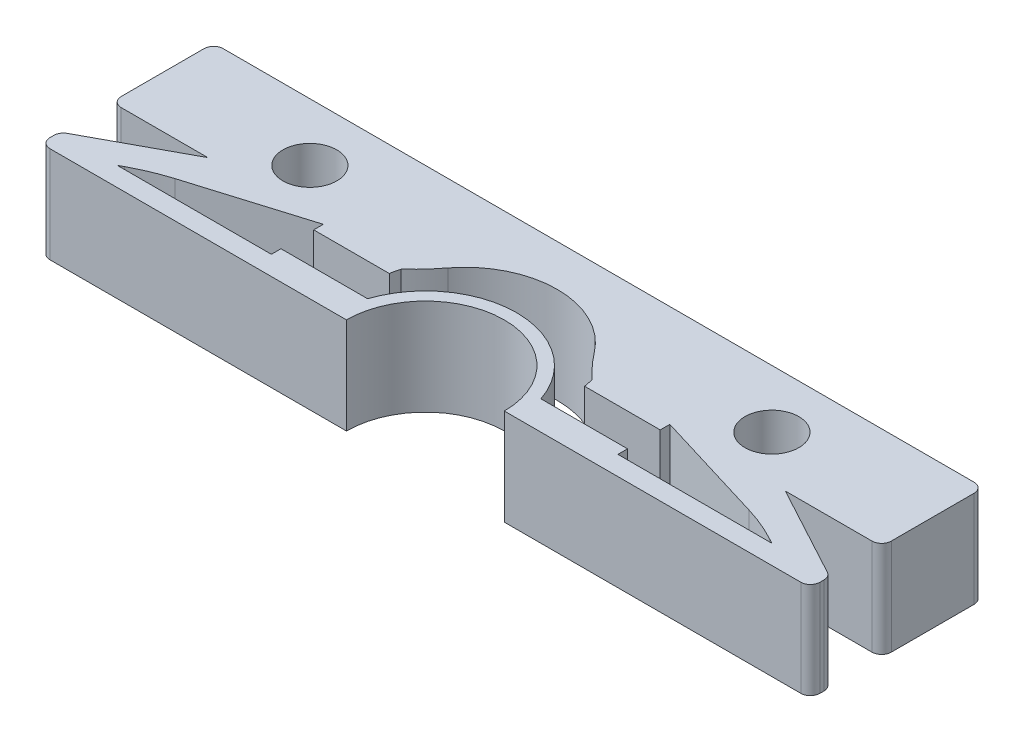
from build123d import *

# Parameters (mm, degrees)
BOSS_EXTRUDE1_DEPTH     = 5
CUT_EXTRUDE1_DEPTH      = 5
CUT_EXTRUDE1_DEPTH_BACK = 10
SKETCH2_R               = 1.4
FILLET1_R               = 10
FILLET2_R               = 0.5
CUT_EXTRUDE3_DEPTH      = 7
SKETCH6_W               = 4.5
SKETCH6_H               = 5
BOSS_EXTRUDE2_DEPTH     = 0.5
SKETCH7_W               = 9
SKETCH7_H               = 1
BOSS_EXTRUDE3_DEPTH     = 5
BOSS_EXTRUDE4_DEPTH     = 5
CUT_EXTRUDE5_START      = 5
SKETCH11_R              = 4.1
CUT_EXTRUDE5_DEPTH      = 5
CUT_EXTRUDE7_DEPTH      = 5
FILLET3_R               = 10


with BuildPart() as part:
    # Sketch1 → Boss-Extrude1 (new body)
    with BuildSketch(Plane(origin=(0, 0, 0), x_dir=(1, 0, 0), z_dir=(0, 1, 0))):
        Polygon((0, 0), (0, 9), (40, 9), (40, 0), (24, 0), (24, 5), (16, 5), (16, 0), align=None)
    extrude(amount=BOSS_EXTRUDE1_DEPTH)

    # Sketch2 → Cut-Extrude1 (cut, two sides: drawn at the far end of the back side and taken through both)
    with BuildSketch(Plane(origin=(0, 5, 0), x_dir=(1, 0, 0), z_dir=(0, 1, 0)).offset(-CUT_EXTRUDE1_DEPTH_BACK)):
        with Locations(Location((8, 6, 0), (0, 0, 270))):
            Circle(SKETCH2_R)
        with Locations(Location((32, 6, 0), (0, 0, 270))):
            Circle(SKETCH2_R)
        Polygon((5, 3.7), (0, 3.7), (0, 1), align=None)
        Polygon((13, 1), (8, 3.7), (3, 1), align=None)
        Polygon((16, 3.7), (11, 3.7), (16, 1), align=None)
        Polygon((24, 3.7), (24, 1), (29, 3.7), align=None)
        Polygon((32, 3.7), (27, 1), (37, 1), align=None)
        Polygon((40, 3.7), (35, 3.7), (40, 1), align=None)
    extrude(amount=CUT_EXTRUDE1_DEPTH + CUT_EXTRUDE1_DEPTH_BACK, mode=Mode.SUBTRACT)

    # Fillet1
    fillet1_edges = [part.edges().sort_by_distance(p)[0] for p in [
        (32, 2.5, -3.7),
        (8, 2.5, -3.7),
    ]]
    fillet(fillet1_edges, radius=FILLET1_R)

    # Fillet2
    fillet2_edges = [part.edges().sort_by_distance(p)[0] for p in [
        (0, 2.5, 0),
        (0, 2.5, -9),
        (40, 2.5, -9),
        (40, 2.5, 0),
        (24, 2.5, 0),
        (24, 2.5, -5),
        (16, 2.5, -5),
        (16, 2.5, 0),
        (0, 2.5, -1),
        (0, 2.5, -3.7),
        (16, 2.5, -3.7),
        (16, 2.5, -1),
        (24, 2.5, -3.7),
        (24, 2.5, -1),
        (40, 2.5, -3.7),
        (40, 2.5, -1),
    ]]
    fillet(fillet2_edges, radius=FILLET2_R)

    # Sketch4 → Cut-Extrude3 (cut)
    with BuildSketch(Plane(origin=(0, 5, 0), x_dir=(1, 0, 0), z_dir=(0, 1, 0))):
        Polygon((10.483197095, 1), (8, 2.335141884), (5.076146091, 1.898147599), (11, 3.7), (16.021662669, 1), align=None)
        Polygon((29.516802905, 1), (32, 2.335141884), (34.923853909, 1.898147599), (29, 3.7), (23.978337331, 1), align=None)
    extrude(amount=-CUT_EXTRUDE3_DEPTH, mode=Mode.SUBTRACT)

    # Sketch6 → Boss-Extrude2 (add)
    with BuildSketch(Plane.XY.offset(-3.7)):
        with Locations((13.25, 2.5)):
            Rectangle(SKETCH6_W, SKETCH6_H)
        with Locations((26.75, 2.5)):
            Rectangle(SKETCH6_W, SKETCH6_H)
    boss_extrude2 = extrude(amount=BOSS_EXTRUDE2_DEPTH)

    # Mirror1: Boss-Extrude2 across plane
    add(boss_extrude2.mirror(Plane.XY.offset(-2.35)))

    # Sketch7 → Boss-Extrude3 (add)
    with BuildSketch(Plane(origin=(0, 5, 0), x_dir=(1, 0, 0), z_dir=(0, 1, 0))):
        with Locations((20, 0.5)):
            Rectangle(SKETCH7_W, SKETCH7_H)
    extrude(amount=-BOSS_EXTRUDE3_DEPTH)

    # Sketch9 → Boss-Extrude4 (add)
    with BuildSketch(Plane(origin=(0, 5, 0), x_dir=(1, 0, 0), z_dir=(0, 1, 0))):
        with BuildLine():
            ThreePointArc((16.02382093, 1), (20, 4.1), (23.97617907, 1))
            Line((23.97617907, 1), (24.5, 1))
            Line((24.5, 1), (24.5, 1.5))
            ThreePointArc((24.5, 1.5), (20, 4.74341649), (15.5, 1.5))
            Line((15.5, 1.5), (15.5, 1))
            Line((15.5, 1), (16.02382093, 1))
        make_face()
    extrude(amount=-BOSS_EXTRUDE4_DEPTH)

    # Sketch11 → Cut-Extrude5 (cut)
    with BuildSketch(Plane(origin=(0, 0, 0), x_dir=(1, 0, 0), z_dir=(0, 1, 0)).offset(CUT_EXTRUDE5_START)):
        with Locations((20, 0)):
            Circle(SKETCH11_R)
    extrude(amount=-CUT_EXTRUDE5_DEPTH, mode=Mode.SUBTRACT)

    # Sketch10 → Cut-Extrude7 (cut)
    with BuildSketch(Plane(origin=(0, 5, 0), x_dir=(1, 0, 0), z_dir=(0, 1, 0))):
        with BuildLine():
            ThreePointArc((15.5, 3.7), (20, 6.85), (24.5, 3.7))
            ThreePointArc((24.5, 3.7), (24.146446609, 3.846446609), (24, 4.2))
            Line((24, 4.2), (24, 4.5))
            ThreePointArc((24, 4.5), (23.853553391, 4.853553391), (23.5, 5))
            Line((23.5, 5), (16.5, 5))
            ThreePointArc((16.5, 5), (16.146446609, 4.853553391), (16, 4.5))
            Line((16, 4.5), (16, 4.2))
            ThreePointArc((16, 4.2), (15.853553391, 3.846446609), (15.5, 3.7))
        make_face()
        with BuildLine():
            Line((24.963087063, 3.7), (24.5, 3.7))
            Line((24.5, 3.7), (24.5, 3.2))
            Line((24.5, 3.2), (25.072694865, 3.2))
            ThreePointArc((25.072694865, 3.2), (25.02411482, 3.451364366), (24.963087063, 3.7))
        make_face()
        with BuildLine():
            Line((15.5, 3.2), (15.5, 3.7))
            Line((15.5, 3.7), (15.036912937, 3.7))
            ThreePointArc((15.036912937, 3.7), (14.97588518, 3.451364366), (14.927305135, 3.2))
            Line((14.927305135, 3.2), (15.5, 3.2))
        make_face()
        with BuildLine():
            Line((15.5, 3.7), (16.031107798, 3.7))
            Line((16.031107798, 3.7), (16.5, 5))
            ThreePointArc((16.5, 5), (16.146446609, 4.853553391), (16, 4.5))
            Line((16, 4.5), (16, 4.2))
            ThreePointArc((16, 4.2), (15.853553391, 3.846446609), (15.5, 3.7))
        make_face()
        with BuildLine():
            Line((24.195310158, 3.7), (24.5, 3.7))
            ThreePointArc((24.5, 3.7), (24.146446609, 3.846446609), (24, 4.2))
            Line((24, 4.2), (24, 4.5))
            ThreePointArc((24, 4.5), (23.853553391, 4.853553391), (23.5, 5))
            Line((23.5, 5), (23.319457032, 5))
            Line((23.319457032, 5), (24.195310158, 3.7))
        make_face()
    extrude(amount=-CUT_EXTRUDE7_DEPTH, mode=Mode.SUBTRACT)

    # Fillet3
    # the kernel refuses this fillet: 10 mm, written as the material it takes off along each edge
    with BuildSketch(Plane(origin=(15.5, 8.6255598, -3.7), x_dir=(-1, 0, 0), z_dir=(0, -1, 0))) as fillet3_piece_1:
        with BuildLine():
            CenterArc((7.243737761, 7.350018783), FILLET3_R, 217.432435618, 9.874939203)
            Line((-0.696968767, 1.271764112), (-0.855782897, 1.150199019))
            ThreePointArc((-0.855782897, 1.150199019), (-0.475456762, 0.566296996), (-0.187919463, -0.068456376))
            Line((-0.187919463, -0.068456376), (0, -0.2))
            ThreePointArc((0, -0.2), (0.231543531, -0.2), (0.327474049, -0.147000376))
            Line((0.327474049, -0.147000376), (0.463087063, 0))
        make_face()
    extrude(amount=12.251119601, mode=Mode.SUBTRACT)
    with BuildSketch(Plane(origin=(24.5, 8.6255598, -3.7), x_dir=(-0.4805938979656583, 0, -0.8769432736717777), z_dir=(0, -1, 0))) as fillet3_piece_2:
        with BuildLine():
            CenterArc((2.964253367, 9.884721283), FILLET3_R, 251.41682279, 9.874939203)
            Line((-0.222556817, 0.406101085), (-0.28629302, 0.216528681))
            ThreePointArc((-0.28629302, 0.216528681), (-0.286667063, 0.106931763), (-0.175388655, -0.09611878))
            Line((-0.175388655, -0.09611878), (0.030280589, -0.197694426))
            ThreePointArc((0.030280589, -0.197694426), (0.72511196, -0.144789729), (1.419943331, -0.197694426))
            Line((1.419943331, -0.197694426), (1.45022392, 0))
        make_face()
    extrude(amount=12.251119601, mode=Mode.SUBTRACT)


solid = part.part
